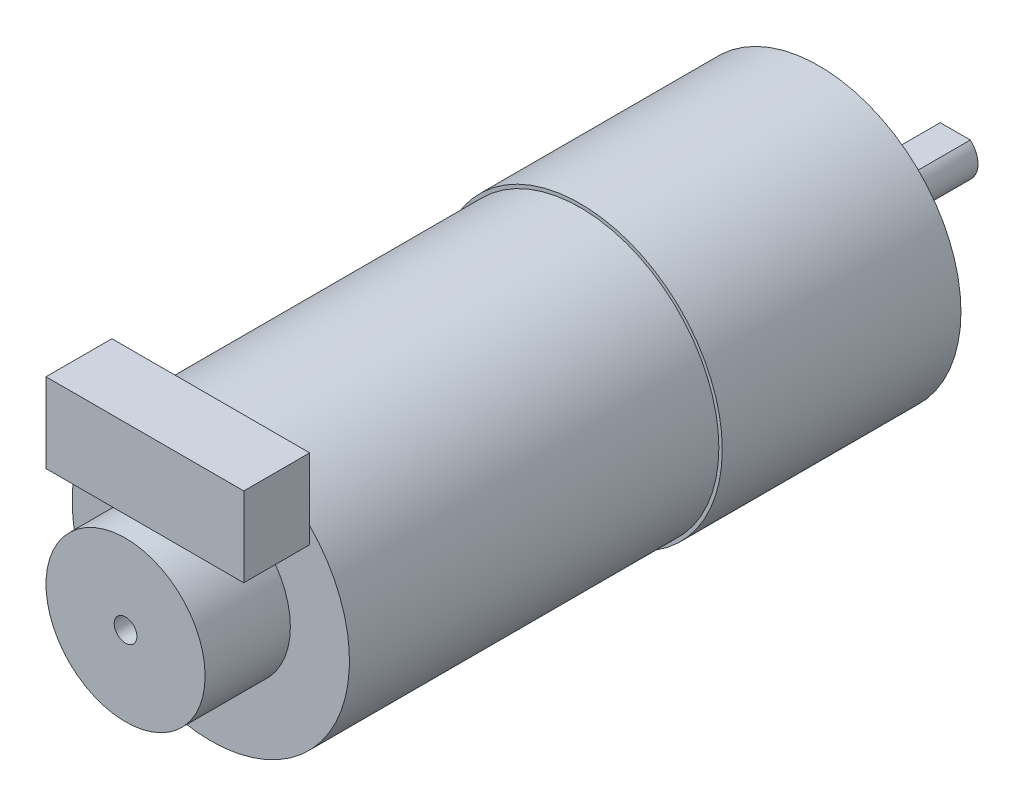
from build123d import *

# Parameters (mm, degrees)
SKETCH1_R            = 2
BOSS_EXTRUDE1_DEPTH  = 9.5
SKETCH3_R            = 3.5
BOSS_EXTRUDE2_DEPTH  = 2.5
SKETCH4_R            = 12.5
BOSS_EXTRUDE3_DEPTH  = 21
SKETCH5_R            = 12.2
BOSS_EXTRUDE4_DEPTH  = 32.5
SKETCH6_R            = 7
BOSS_EXTRUDE5_DEPTH  = 7.5
CUT_EXTRUDE1_DEPTH   = 8
SKETCH8_R            = 3
CUT_EXTRUDE2_DEPTH   = 5
THREAD1_PITCH        = 0.5
THREAD2_PITCH        = 0.5
BOSS_EXTRUDE11_DEPTH = 5.8
SKETCH17_R           = 1
CUT_EXTRUDE3_DEPTH   = 3


with BuildPart() as part:
    # Sketch1 → Boss-Extrude1 (new body)
    with BuildSketch(Plane.XY):
        Circle(SKETCH1_R)
    extrude(amount=BOSS_EXTRUDE1_DEPTH)

    # Sketch3 → Boss-Extrude2 (add)
    with BuildSketch(Plane.XY.offset(9.5)):
        Circle(SKETCH3_R)
    extrude(amount=BOSS_EXTRUDE2_DEPTH)

    # Sketch4 → Boss-Extrude3 (add)
    with BuildSketch(Plane.XY.offset(12)):
        with Locations(Location((0, 0, 0), (0, 0, 180))):
            Circle(SKETCH4_R)
    extrude(amount=BOSS_EXTRUDE3_DEPTH)

    # Sketch5 → Boss-Extrude4 (add)
    with BuildSketch(Plane.XY.offset(33)):
        Circle(SKETCH5_R)
    extrude(amount=BOSS_EXTRUDE4_DEPTH)

    # Sketch6 → Boss-Extrude5 (add)
    with BuildSketch(Plane.XY.offset(65.5)):
        Circle(SKETCH6_R)
    extrude(amount=BOSS_EXTRUDE5_DEPTH)

    # Sketch7 → Cut-Extrude1 (cut)
    with BuildSketch(Plane(origin=(0, 0, 0), x_dir=(-1, 0, 0), z_dir=(0, 0, -1))):
        with BuildLine():
            Line((0, 1.5), (1.322875656, 1.5))
            ThreePointArc((1.322875656, 1.5), (0, 2), (-1.322875656, 1.5))
            Line((-1.322875656, 1.5), (0, 1.5))
        make_face()
    extrude(amount=-CUT_EXTRUDE1_DEPTH, mode=Mode.SUBTRACT)

    # Sketch8 → Cut-Extrude2 (cut)
    with BuildSketch(Plane(origin=(0, 0, 12), x_dir=(-1, 0, 0), z_dir=(0, 0, -1))):
        with Locations((8.5, 0)):
            Circle(SKETCH8_R)
        with Locations((0, -8.5)):
            Circle(SKETCH8_R)
        with Locations((-8.5, 0)):
            Circle(SKETCH8_R)
        with Locations((0, 8.5)):
            Circle(SKETCH8_R)
    extrude(amount=-CUT_EXTRUDE2_DEPTH, mode=Mode.SUBTRACT)

    # Thread1: the profile of Thread Profile1 profile screwed along a right-hand helix of 10 turns, 6 arcs to a turn; built about Z, then put on its axis
    thread1_z = Axis((0, 0, 0), (0, 0, 1))
    thread1_corners = [(3.0003, 0, -0.000173205), (3.0003, 0, 0.437673204), (2.729367062, 0, 0.281249999), (2.729367062, 0, 0.156249999)]
    with BuildLine(mode=Mode.PRIVATE) as thread1_profile:
        Line(thread1_corners[0], thread1_corners[1])
        Line(thread1_corners[1], thread1_corners[2])
        Line(thread1_corners[2], thread1_corners[3])
        Line(thread1_corners[3], thread1_corners[0])
    thread1_cap = Face(thread1_profile.wire())
    thread1_turn_angles = [0, 30, 60, 90, 120, 150, 180, 210, 240, 270, 300, 330, 360]
    thread1_turn_weights = [1, 0.8660254037844387, 1, 0.8660254037844387, 1, 0.8660254037844387, 1, 0.8660254037844387, 1, 0.8660254037844387, 1, 0.8660254037844387, 1]
    thread1_turn_rails = [Edge.make_bspline([Vector(p[0], p[1], 0).rotate(thread1_z, thread1_turn_angles[k]) / thread1_turn_weights[k] + Vector(0, 0, p[2] + THREAD1_PITCH * thread1_turn_angles[k] / 360) for k in range(13)], [0, 0, 0, 1, 1, 2, 2, 3, 3, 4, 4, 5, 5, 6, 6, 6], 2, thread1_turn_weights) for p in thread1_corners]
    thread1_turn_sides = [Face.make_surface_from_curves(thread1_turn_rails[p[0]], thread1_turn_rails[p[1]]) for p in [(0, 1), (1, 2), (2, 3), (3, 0)]]
    thread1 = Plane(origin=(8.5, 0, 17), x_dir=(-1, 0, 0), z_dir=(0, 0, -1)) * Solid(Shell([*[p.moved(Location((0, 0, THREAD1_PITCH * i))) for i in range(10) for p in thread1_turn_sides], thread1_cap, thread1_cap.rotate(thread1_z, 3600).moved(Location((0, 0, THREAD1_PITCH * 3600 / 360)))]))
    add(thread1)

    # Thread2: the profile of Thread Profile2 profile screwed along a right-hand helix of 10 turns, 6 arcs to a turn; built about Z, then put on its axis
    thread2_z = Axis((0, 0, 0), (0, 0, 1))
    thread2_corners = [(3.0003, 0, -0.000173205), (3.0003, 0, 0.437673204), (2.729367062, 0, 0.281249999), (2.729367062, 0, 0.156249999)]
    with BuildLine(mode=Mode.PRIVATE) as thread2_profile:
        Line(thread2_corners[0], thread2_corners[1])
        Line(thread2_corners[1], thread2_corners[2])
        Line(thread2_corners[2], thread2_corners[3])
        Line(thread2_corners[3], thread2_corners[0])
    thread2_cap = Face(thread2_profile.wire())
    thread2_turn_angles = [0, 30, 60, 90, 120, 150, 180, 210, 240, 270, 300, 330, 360]
    thread2_turn_weights = [1, 0.8660254037844387, 1, 0.8660254037844387, 1, 0.8660254037844387, 1, 0.8660254037844387, 1, 0.8660254037844387, 1, 0.8660254037844387, 1]
    thread2_turn_rails = [Edge.make_bspline([Vector(p[0], p[1], 0).rotate(thread2_z, thread2_turn_angles[k]) / thread2_turn_weights[k] + Vector(0, 0, p[2] + THREAD2_PITCH * thread2_turn_angles[k] / 360) for k in range(13)], [0, 0, 0, 1, 1, 2, 2, 3, 3, 4, 4, 5, 5, 6, 6, 6], 2, thread2_turn_weights) for p in thread2_corners]
    thread2_turn_sides = [Face.make_surface_from_curves(thread2_turn_rails[p[0]], thread2_turn_rails[p[1]]) for p in [(0, 1), (1, 2), (2, 3), (3, 0)]]
    thread2 = Plane(origin=(-8.5, 0, 17), x_dir=(-1, 0, 0), z_dir=(0, 0, -1)) * Solid(Shell([*[p.moved(Location((0, 0, THREAD2_PITCH * i))) for i in range(10) for p in thread2_turn_sides], thread2_cap, thread2_cap.rotate(thread2_z, 3600).moved(Location((0, 0, THREAD2_PITCH * 3600 / 360)))]))
    add(thread2)

    # Sketch16 → Boss-Extrude11 (add)
    with BuildSketch(Plane.XY.offset(65.5)):
        Polygon((0, 7.1), (8.7, 7.1), (8.7, 14.1), (8.3, 14.1), (-8.7, 14.1), (-8.7, 7.1), align=None)
    extrude(amount=BOSS_EXTRUDE11_DEPTH)

    # Sketch17 → Cut-Extrude3 (cut)
    with BuildSketch(Plane.XY.offset(73)):
        Circle(SKETCH17_R)
    extrude(amount=-CUT_EXTRUDE3_DEPTH, mode=Mode.SUBTRACT)


solid = part.part
